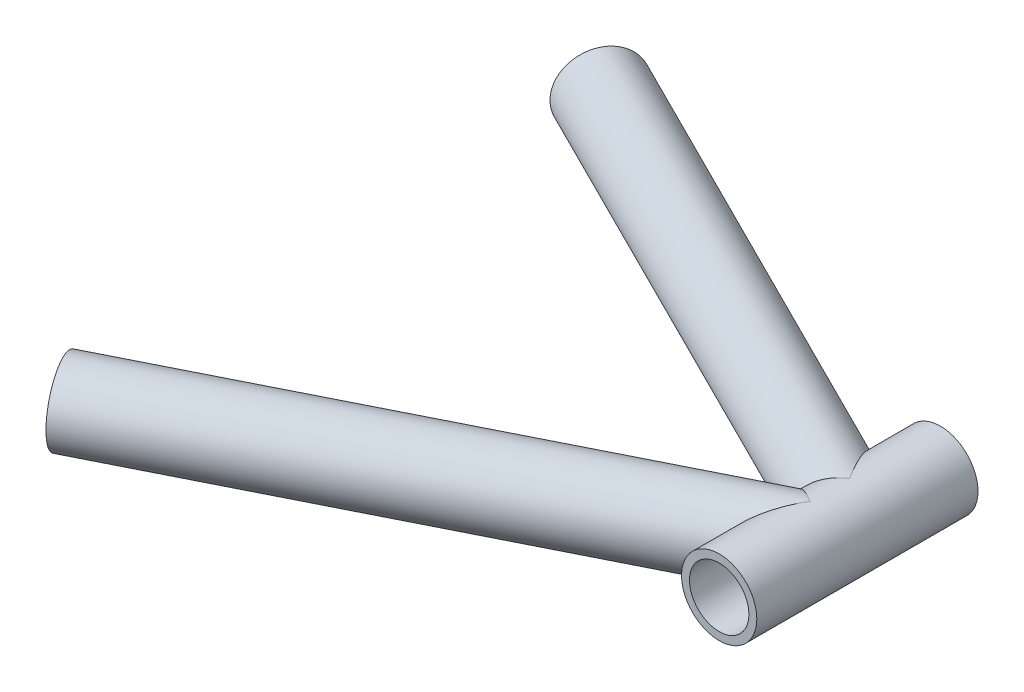
from build123d import *

# Parameters (mm, degrees)
SWEEP2_START            = -34.435446853
SWEEP2_OUTLINE_R        = 9.525
SWEEP2_OUTLINE_R_2      = 7.525
SWEEP2_DEPTH            = 160.996894379
CUT_EXTRUDE2_DEPTH      = 172.421230045
CUT_EXTRUDE2_DEPTH_BACK = 172.421230045
SKETCH5_3_R             = 9.525
SKETCH5_R               = 9.525
SKETCH5_R_2             = 7.525
BOSS_EXTRUDE6_DEPTH     = 28
SKETCH3_3_R             = 9.525
SKETCH3_3_R_2           = 7.525
CUT_EXTRUDE3_DEPTH      = 20
BOSS_EXTRUDE7_START     = -20
SKETCH3_4_R             = 7.525
SKETCH3_4_R_2           = 4
BOSS_EXTRUDE7_DEPTH     = 20
SKETCH7_R               = 7.525
CUT_EXTRUDE4_DEPTH      = 187.001646868


# Read off the part's stored shape, not the designer's step: Sweep2
with BuildPart() as part:
    # Sweep2 outline → Sweep2 (new body)
    with BuildSketch(Plane(origin=(0, 0, 0), x_dir=(0.4472135954999576, 0, -0.8944271909999161), z_dir=(0.894427190999916, 0, 0.447213595499958)).offset(SWEEP2_START)):
        with Locations((68.870893707, 0)):
            Circle(SWEEP2_OUTLINE_R)
        with Locations((68.870893707, 0)):
            Circle(SWEEP2_OUTLINE_R_2, mode=Mode.SUBTRACT)
    sweep2 = extrude(amount=SWEEP2_DEPTH)

    # Sketch5<3> → Cut-Extrude2 (cut, two sides: drawn at the far end of the back side and taken through both)
    with BuildSketch(Plane.XY.offset(-CUT_EXTRUDE2_DEPTH_BACK)):
        with Locations((144, 0)):
            Circle(SKETCH5_3_R)
    extrude(amount=CUT_EXTRUDE2_DEPTH + CUT_EXTRUDE2_DEPTH_BACK, mode=Mode.SUBTRACT)

    # Sketch5 → Boss-Extrude6 (add)
    with BuildSketch(Plane.XY):
        with Locations((144, 0)):
            Circle(SKETCH5_R)
        with Locations((144, 0)):
            Circle(SKETCH5_R_2, mode=Mode.SUBTRACT)
    boss_extrude6 = extrude(amount=-BOSS_EXTRUDE6_DEPTH)

    # Sketch3<3> → Cut-Extrude3 (cut)
    with BuildSketch(Plane(origin=(0, 0, -77), x_dir=(-0.447213595499958, 0, 0.894427190999916), z_dir=(-0.8944271909999159, 0, -0.4472135954999579))):
        Circle(SKETCH3_3_R)
        Circle(SKETCH3_3_R_2, mode=Mode.SUBTRACT)
    cut_extrude3 = extrude(amount=-CUT_EXTRUDE3_DEPTH, mode=Mode.SUBTRACT)

    # Mirror2: Sweep2, Boss-Extrude6, Cut-Extrude3 across plane
    add(sweep2.mirror(Plane.XY))
    add(boss_extrude6.mirror(Plane.XY))
    add(cut_extrude3.mirror(Plane.XY), mode=Mode.SUBTRACT)

    # Sketch7 → Cut-Extrude4 (cut, through all)
    with BuildSketch(Plane(origin=(0, 0, -28), x_dir=(-1, 0, 0), z_dir=(0, 0, -1))):
        with Locations(Location((-144, 0, 0), (0, 0, 180))):
            Circle(SKETCH7_R)
    extrude(amount=-CUT_EXTRUDE4_DEPTH, mode=Mode.SUBTRACT)


with BuildPart() as body_2:
    # Sketch3<4> → Boss-Extrude7 (new body)
    with BuildSketch(Plane(origin=(0, 0, -77), x_dir=(-0.447213595499958, 0, 0.894427190999916), z_dir=(-0.8944271909999159, 0, -0.4472135954999579)).offset(BOSS_EXTRUDE7_START)):
        Circle(SKETCH3_4_R)
        Circle(SKETCH3_4_R_2, mode=Mode.SUBTRACT)
    extrude(amount=-BOSS_EXTRUDE7_DEPTH)


with BuildPart() as body_3:
    # Mirror5: mirrored copy
    add(body_2.part.mirror(Plane.XY))


solid = Compound([part.part, body_2.part, body_3.part])
